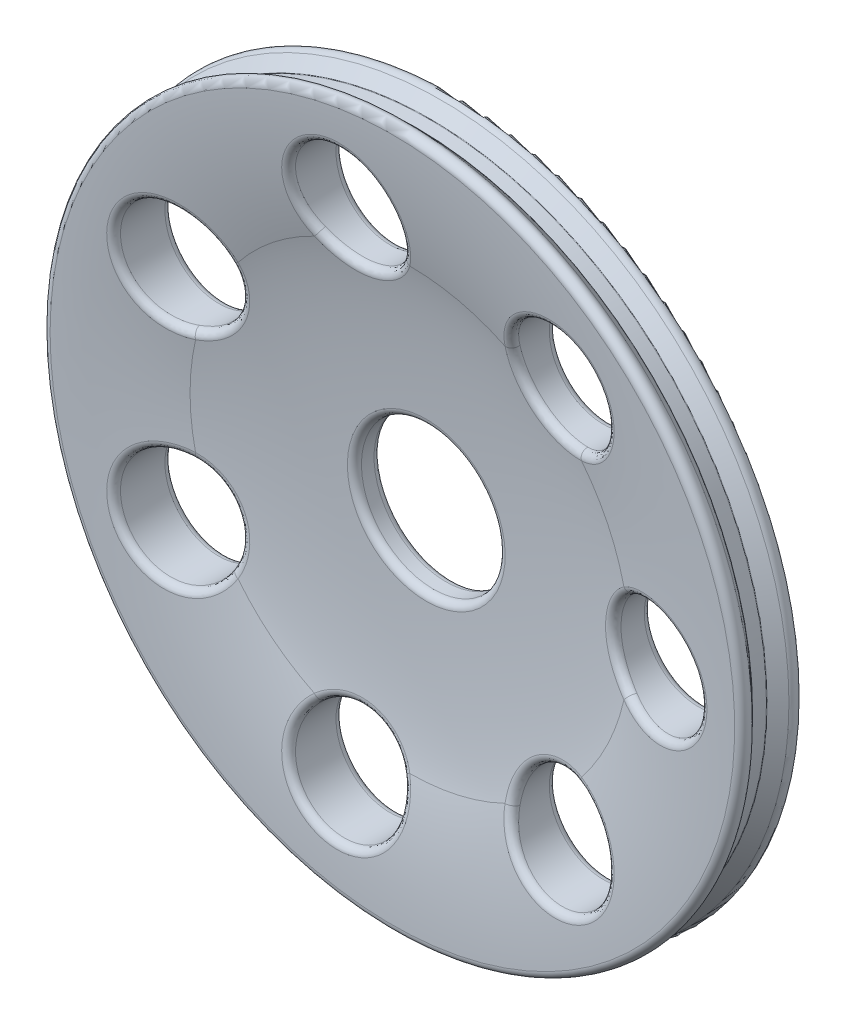
from build123d import *

# Parameters (mm, degrees)
SKETCH1_R               = 5
BOSS_EXTRUDE1_DEPTH     = 0.425
FILLET1_R               = 8
CUT_EXTRUDE3_DEPTH      = 8.083828561
CUT_EXTRUDE3_DEPTH_BACK = 8.083828561
SKETCH5_R               = 0.75
FILLET2_R               = 0.1
CUT_EXTRUDE5_DEPTH      = 7.884199287
CUT_EXTRUDE5_DEPTH_BACK = 7.884199287
SKETCH7_R               = 1
FILLET3_R               = 0.1
FILLET4_R               = 0.01


# Read off the part's stored shape, not the designer's step: Dome1
with BuildPart() as part:
    # Sketch1 → Boss-Extrude1 (new, symmetric)
    with BuildSketch(Plane.XY):
        Circle(SKETCH1_R)
    extrude(amount=BOSS_EXTRUDE1_DEPTH, both=True)

    # Dome1 outline → Dome1 (revolve, cut)
    with BuildSketch(Plane.XZ):
        with BuildLine():
            Line((0, 0.4250001), (0, -0.075))
            add(Edge.make_bspline(
                [(0, -0.075), (3.5, -0.075), (3.5, 0.425)],
                knots=[4.71238898, 4.71238898, 4.71238898, 6.283185307, 6.283185307, 6.283185307], degree=2, weights=[1, 0.707106781, 1]))
            Line((3.5, 0.425), (0, 0.4250001))
        make_face()
    revolve(axis=Axis((0, 0, 0), (0, 0, 1)), mode=Mode.SUBTRACT)

    # Fillet1
    # the kernel refuses this fillet: 8 mm, written as the material it takes off along each edge
    with BuildSketch(Plane(origin=(0, 0, 0.425), x_dir=(1, 0, 0), z_dir=(0, -1, 0))) as fillet1_piece_1:
        with BuildLine():
            CenterArc((5.015774381, -7.999984448), FILLET1_R, 90.112975752, 14.11605463)
            Line((3.04938599, -0.245416975), (3.010058222, -0.090325625))
            ThreePointArc((3.010058222, -0.090325625), (3.234168265, -0.02061042), (3.34, 0))
            Line((3.34, 0), (3.5, 0.16))
            ThreePointArc((3.5, 0.16), (4.25, 0.16), (4.999684512, 0.159999689))
            Line((4.999684512, 0.159999689), (5, 0))
        make_face()
    revolve(axis=Axis((0, 0, 0.425), (0, 0, 1)), mode=Mode.SUBTRACT)

    # Sketch5 → Cut-Extrude3 (cut, two sides: drawn at the far end of the back side and taken through both)
    with BuildSketch(Plane.XY.offset(-CUT_EXTRUDE3_DEPTH_BACK)):
        with Locations(Location((3.5, 0, 0), (0, 0, 180))):
            Circle(SKETCH5_R)
        with Locations(Location((2.182214307, -2.736410189, 0), (0, 0, 176.55954543))):
            Circle(SKETCH5_R)
        with Locations(Location((-0.778823269, -3.412247693, 0), (0, 0, 125.130969463))):
            Circle(SKETCH5_R)
        with Locations(Location((-3.153391038, -1.518593087, 0), (0, 0, 73.702400558))):
            Circle(SKETCH5_R)
        with Locations(Location((-3.153391038, 1.518593087, 0), (0, 0, 223.333172443))):
            Circle(SKETCH5_R)
        with Locations(Location((-0.778823269, 3.412247693, 0), (0, 0, 234.869030448))):
            Circle(SKETCH5_R)
        with Locations(Location((2.182214307, 2.736410189, 0), (0, 0, 183.44045902))):
            Circle(SKETCH5_R)
    extrude(amount=CUT_EXTRUDE3_DEPTH + CUT_EXTRUDE3_DEPTH_BACK, mode=Mode.SUBTRACT)

    # Sketch6 → Cut-Revolve2 (revolve, cut)
    with BuildSketch(Plane(origin=(0, 0, 0), x_dir=(1, 0, 0), z_dir=(0, 1, 0))):
        Polygon((5, 0.425), (4.675, 0.1), (4.675, -0.1), (5, -0.425), align=None)
    revolve(axis=Axis((0, 0, -0.425), (0, 0, 1)), mode=Mode.SUBTRACT)

    # Fillet2
    fillet2_edges = [part.edges().sort_by_distance(p)[0] for p in [
        (3.798702784, -0.687951038, 0.341159112),
        (2.649831658, 3.322783799, 0.38828056),
        (-0.945713968, 4.143443626, 0.38828056),
        (-3.553405217, 2.153013023, 0.378548082),
        (-3.829117681, -1.844005905, 0.38828056),
        (-0.94571397, -4.143443626, 0.38828056),
        (2.64983168, -3.322783781, 0.38828056),
        (1.714597433, -2.150036196, 0.115705213),
        (2.930862585, -2.781418575, -0.425),
        (-0.611931943, -2.681051901, 0.115705213),
        (-0.347237724, -4.02562679, -0.425),
        (-2.477664116, -1.193180845, 0.115705213),
        (-3.363860909, -2.238455875, -0.425),
        (-2.477664387, 1.193180282, 0.115705213),
        (-2.607859361, 2.033272783, -0.425),
        (-0.611931945, 2.681051901, 0.115705213),
        (-0.347237723, 4.025626789, -0.425),
        (1.714597455, 2.150036178, 0.115705213),
        (2.930862582, 2.781418633, -0.425),
        (2.81549862, -0.306525468, 0.13122063),
        (4.25, 0, -0.425),
        (-5, 0, -0.425),
        (-5, 0, 0.425),
    ]]
    fillet(fillet2_edges, radius=FILLET2_R)

    # Sketch7 → Cut-Extrude5 (cut, two sides: drawn at the far end of the back side and taken through both)
    with BuildSketch(Plane.XY.offset(-CUT_EXTRUDE5_DEPTH_BACK)):
        Circle(SKETCH7_R)
    extrude(amount=CUT_EXTRUDE5_DEPTH + CUT_EXTRUDE5_DEPTH_BACK, mode=Mode.SUBTRACT)

    # Fillet3
    fillet3_edges = [part.edges().sort_by_distance(p)[0] for p in [
        (-1, 0, -0.054157424),
        (-1, 0, -0.425),
    ]]
    fillet(fillet3_edges, radius=FILLET3_R)

    # Fillet4
    fillet4_edges = [part.edges().sort_by_distance(p)[0] for p in [
        (-4.675, 0, -0.1),
        (-4.675, 0, 0.1),
    ]]
    fillet(fillet4_edges, radius=FILLET4_R)


solid = part.part
